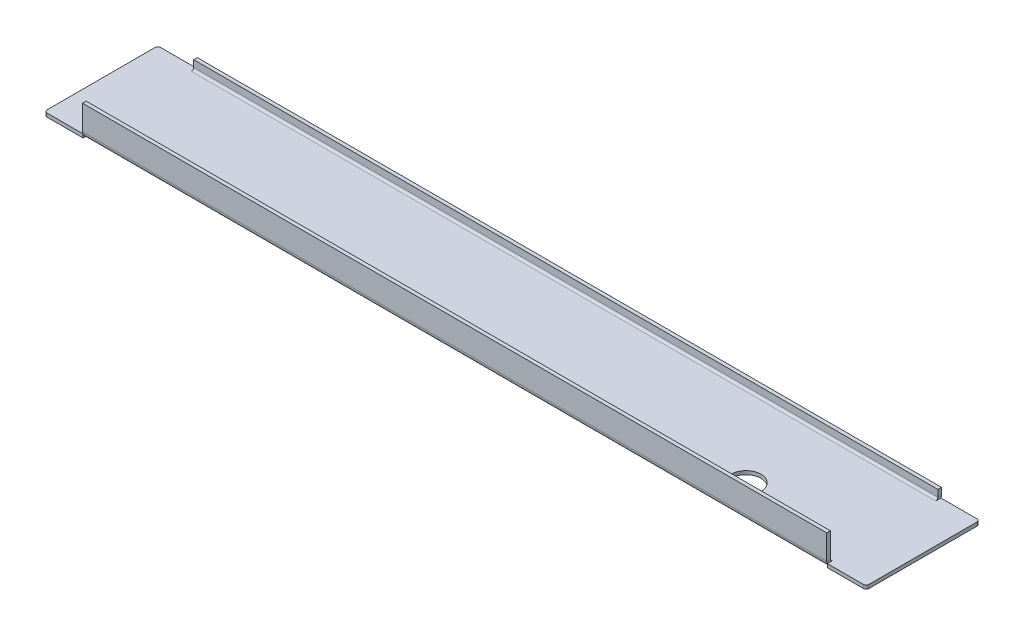
from build123d import *

# Parameters (mm, degrees)
FLANGE_BASE2_DEPTH       = 137.5
CORTE_EXTRUS_O3_START    = -137.5
CORTE_EXTRUS_O3_DEPTH    = 13
CORTE_EXTRUS_O3_START_2  = 124.5
CORTE_EXTRUS_O3_2_DEPTH  = 13
ESBO_O12_W               = 13
ESBO_O12_H               = 1.2
RESSALTO_EXTRUS_O1_DEPTH = 19
FILETE1_R                = 1
ESBO_O13_R               = 5
CORTE_EXTRUS_O4_DEPTH    = 140.208225332


# Read off the part's stored shape, not the designer's step: Corte-extrusão3
# Sheet-metal steps are written as plain solids
with BuildPart() as part:
    # Esboço1 → Flange-base2 (new, symmetric)
    with BuildSketch(Plane(origin=(0, 0, 0), x_dir=(0, 0, -1), z_dir=(1, 0, 0))):
        with BuildLine():
            Line((-18, 9), (-18, 0.7366))
            ThreePointArc((-18, 0.7366), (-17.784254855, 0.215745145), (-17.2634, 0))
            Line((-17.2634, 0), (17.2634, 0))
            ThreePointArc((17.2634, 0), (17.784254855, 0.215745145), (18, 0.7366))
            Line((18, 0.7366), (18, 3))
            Line((18, 3), (19.2, 3))
            Line((19.2, 3), (19.2, 0.7366))
            ThreePointArc((19.2, 0.7366), (18.632782992, -0.632782992), (17.2634, -1.2))
            Line((17.2634, -1.2), (-17.2634, -1.2))
            ThreePointArc((-17.2634, -1.2), (-18.632782992, -0.632782992), (-19.2, 0.7366))
            Line((-19.2, 0.7366), (-19.2, 9))
            Line((-19.2, 9), (-18, 9))
        make_face()
    extrude(amount=FLANGE_BASE2_DEPTH, both=True)

    # Corte-extrusão3 outline → Corte-extrusão3 (cut)
    with BuildSketch(Plane.YZ.offset(CORTE_EXTRUS_O3_START)):
        with BuildLine():
            Line((-1.2, 17.2634), (0, 17.2634))
            ThreePointArc((0, 17.2634), (0.215745145, 17.784254855), (0.7366, 18))
            Line((0.7366, 18), (9, 18))
            Line((9, 18), (9, 19.2))
            Line((9, 19.2), (0.7366, 19.2))
            ThreePointArc((0.7366, 19.2), (-0.632782992, 18.632782992), (-1.2, 17.2634))
        make_face()
        with BuildLine():
            ThreePointArc((0.7366, -18), (0.215745145, -17.784254855), (0, -17.2634))
            Line((0, -17.2634), (-1.2, -17.2634))
            ThreePointArc((-1.2, -17.2634), (-0.632782992, -18.632782992), (0.7366, -19.2))
            Line((0.7366, -19.2), (3, -19.2))
            Line((3, -19.2), (3, -18))
            Line((3, -18), (0.7366, -18))
        make_face()
    extrude(amount=CORTE_EXTRUS_O3_DEPTH, mode=Mode.SUBTRACT)

    # Corte-extrus_o3 2 outline → Corte-extrus_o3 2 (cut)
    with BuildSketch(Plane.YZ.offset(CORTE_EXTRUS_O3_START_2)):
        with BuildLine():
            Line((-1.2, 17.2634), (0, 17.2634))
            ThreePointArc((0, 17.2634), (0.215745145, 17.784254855), (0.7366, 18))
            Line((0.7366, 18), (9, 18))
            Line((9, 18), (9, 19.2))
            Line((9, 19.2), (0.7366, 19.2))
            ThreePointArc((0.7366, 19.2), (-0.632782992, 18.632782992), (-1.2, 17.2634))
        make_face()
        with BuildLine():
            ThreePointArc((0.7366, -18), (0.215745145, -17.784254855), (0, -17.2634))
            Line((0, -17.2634), (-1.2, -17.2634))
            ThreePointArc((-1.2, -17.2634), (-0.632782992, -18.632782992), (0.7366, -19.2))
            Line((0.7366, -19.2), (3, -19.2))
            Line((3, -19.2), (3, -18))
            Line((3, -18), (0.7366, -18))
        make_face()
    extrude(amount=CORTE_EXTRUS_O3_2_DEPTH, mode=Mode.SUBTRACT)

    # Esboço12 → Ressalto-extrusão1 (add, symmetric)
    with BuildSketch(Plane.XY):
        with Locations((131, -0.6)):
            Rectangle(ESBO_O12_W, ESBO_O12_H)
        with Locations((-131, -0.6)):
            Rectangle(ESBO_O12_W, ESBO_O12_H)
    extrude(amount=RESSALTO_EXTRUS_O1_DEPTH, both=True)

    # Filete1
    filete1_edges = [part.edges().sort_by_distance(p)[0] for p in [
        (137.5, -0.6, -19),
        (137.5, -0.6, 19),
        (-137.5, -0.6, -19),
        (-137.5, -0.6, 19),
    ]]
    fillet(filete1_edges, radius=FILETE1_R)

    # Esboço13 → Corte-extrusão4 (cut, through all)
    with BuildSketch(Plane.XZ.offset(1.2)):
        with Locations(Location((87.5, 9.2, 0), (0, 0, 270))):
            Circle(ESBO_O13_R)
    extrude(amount=-CORTE_EXTRUS_O4_DEPTH, mode=Mode.SUBTRACT)


solid = part.part
